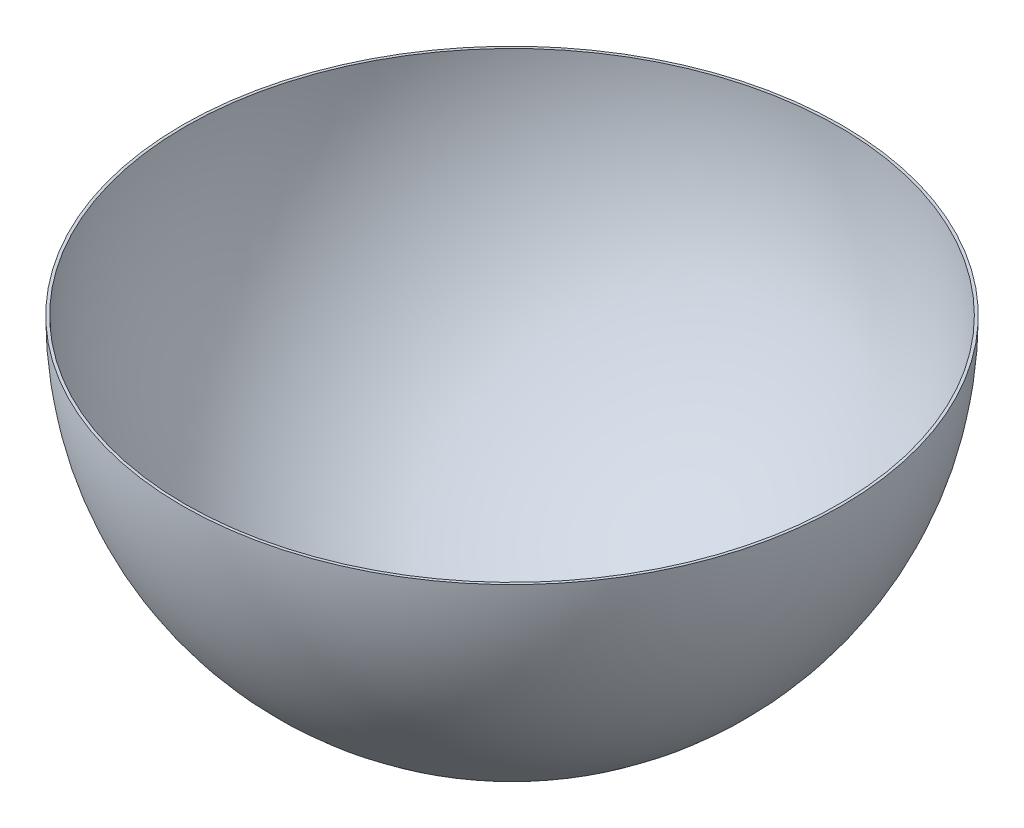
from build123d import *

# Parameters (mm, degrees)
REVOLVE1_ANGLE     = 180
SKETCH2_R          = 6.35
CUT_EXTRUDE1_DEPTH = 396.94681461


with BuildPart() as part:
    # Sketch1 → Revolve1 (revolve)
    with BuildSketch(Plane(origin=(0, 0, 0), x_dir=(1, 0, 0), z_dir=(0, 1, 0))):
        with BuildLine():
            Line((0, 228.6), (0, 226.695))
            ThreePointArc((0, 226.695), (226.695, 0), (0, -226.695))
            Line((0, -226.695), (0, -228.6))
            ThreePointArc((0, -228.6), (228.6, 0), (0, 228.6))
        make_face()
    revolve(axis=Axis((0, 0, 226.695), (0, 0, -1)), revolution_arc=REVOLVE1_ANGLE)

    # Sketch2 → Cut-Extrude1 (cut, through all)
    with BuildSketch(Plane(origin=(0, -228.6, 0), x_dir=(-1, 0, 0), z_dir=(0, -1, 0))):
        Circle(SKETCH2_R)
    extrude(amount=-CUT_EXTRUDE1_DEPTH, mode=Mode.SUBTRACT)


solid = part.part
